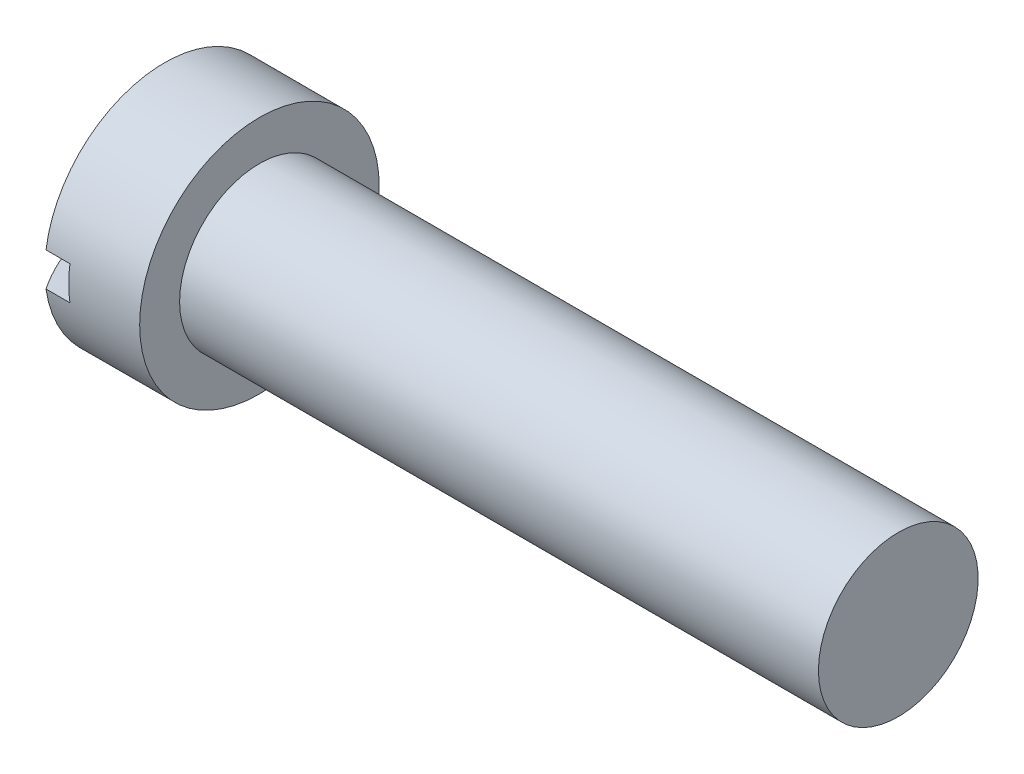
from build123d import *

# Parameters (mm, degrees)
SKETCH2_W  = 19.05
SKETCH2_H  = 2.6924
SLOT_DEPTH = 4.826


with BuildPart() as part:
    # BodySke → Base-Revolve (revolve)
    with BuildSketch(Plane.XY):
        with BuildLine():
            Line((10.4648, 6.35), (10.4648, 9.525))
            Line((10.4648, 9.525), (2.921, 9.525))
            ThreePointArc((2.921, 9.525), (0.746656199, 4.981412099), (0, 0))
            Line((0, 0), (61.2648, 0))
            Line((61.2648, 0), (61.2648, 6.35))
            Line((61.2648, 6.35), (10.4648, 6.35))
        make_face()
    revolve(axis=Axis((-25.4, 0, 0), (1, 0, 0)))

    # Sketch2 → Slot (cut)
    with BuildSketch(Plane(origin=(0, 0, 0), x_dir=(0, 0, -1), z_dir=(1, 0, 0))):
        Rectangle(SKETCH2_W, SKETCH2_H)
    extrude(amount=SLOT_DEPTH, mode=Mode.SUBTRACT)


solid = part.part
